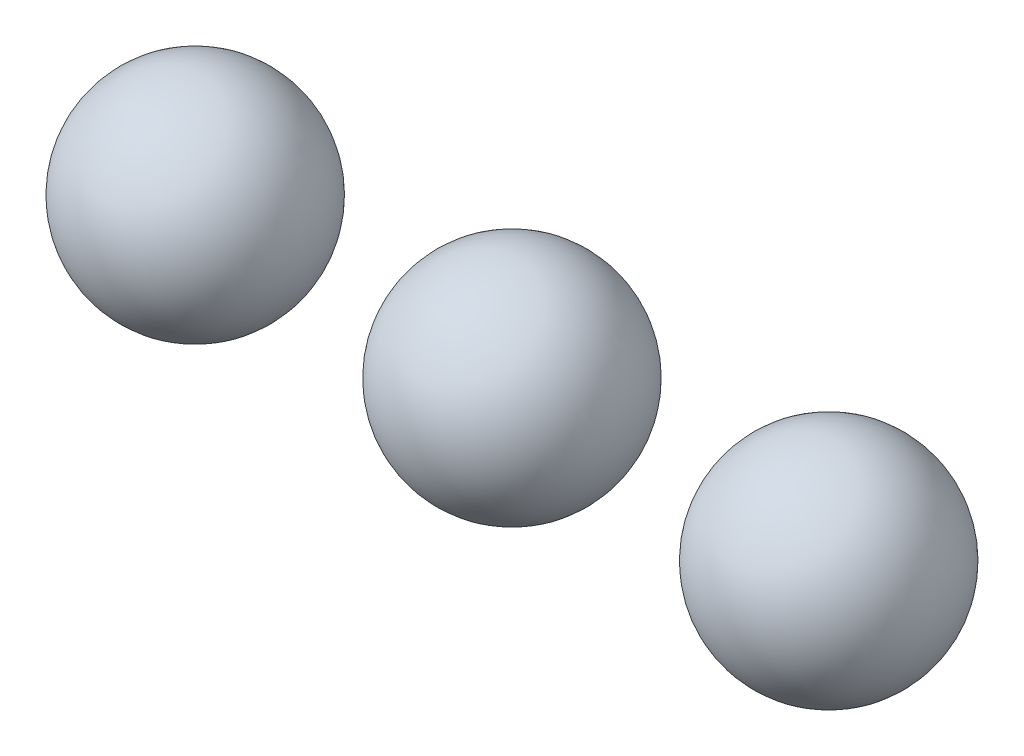
from build123d import *


with BuildPart() as part:
    # 草图1 → 旋转3 (revolve)
    with BuildSketch(Plane.XY):
        with BuildLine():
            ThreePointArc((0, -20), (20, 0), (0, 20))
            Line((0, 20), (0, -20))
        make_face()
    revolve(axis=Axis((0, 20, 0), (0, -1, 0)))


with BuildPart() as body_2:
    # 草图1<4> → 旋转4 (revolve)
    with BuildSketch(Plane.XY):
        with BuildLine():
            ThreePointArc((60, -20), (80, 0), (60, 20))
            Line((60, 20), (60, -20))
        make_face()
    revolve(axis=Axis((60, 20, 0), (0, -1, 0)))


with BuildPart() as body_3:
    # 草图1<5> → 旋转5 (revolve)
    with BuildSketch(Plane.XY):
        with BuildLine():
            ThreePointArc((120, -20), (140, 0), (120, 20))
            Line((120, 20), (120, -20))
        make_face()
    revolve(axis=Axis((120, 20, 0), (0, -1, 0)))


solid = Compound([part.part, body_2.part, body_3.part])
